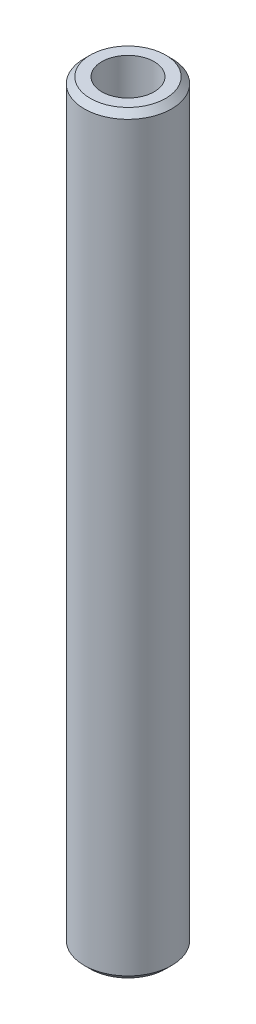
from build123d import *

# Parameters (mm, degrees)
SKETCH1_R           = 30
BOSS_EXTRUDE1_DEPTH = 517.986169419
SKETCH2_R           = 17.982147013
CUT_EXTRUDE1_DEPTH  = 520.720763208
CHAMFER1_SIZE       = 4.14989432


with BuildPart() as part:
    # Sketch1 → Boss-Extrude1 (new body)
    with BuildSketch(Plane(origin=(0, 0, 0), x_dir=(1, 0, 0), z_dir=(0, 1, 0))):
        Circle(SKETCH1_R)
    extrude(amount=BOSS_EXTRUDE1_DEPTH)

    # Sketch2 → Cut-Extrude1 (cut, through all)
    with BuildSketch(Plane(origin=(0, 0, 0), x_dir=(1, 0, 0), z_dir=(0, 1, 0))):
        Circle(SKETCH2_R)
    extrude(amount=CUT_EXTRUDE1_DEPTH, mode=Mode.SUBTRACT)

    # Chamfer1
    chamfer1_edges = [part.edges().sort_by_distance(p)[0] for p in [
        (-30, 517.986169419, 0),
        (-30, 0, 0),
    ]]
    chamfer(chamfer1_edges, length=CHAMFER1_SIZE)


solid = part.part
